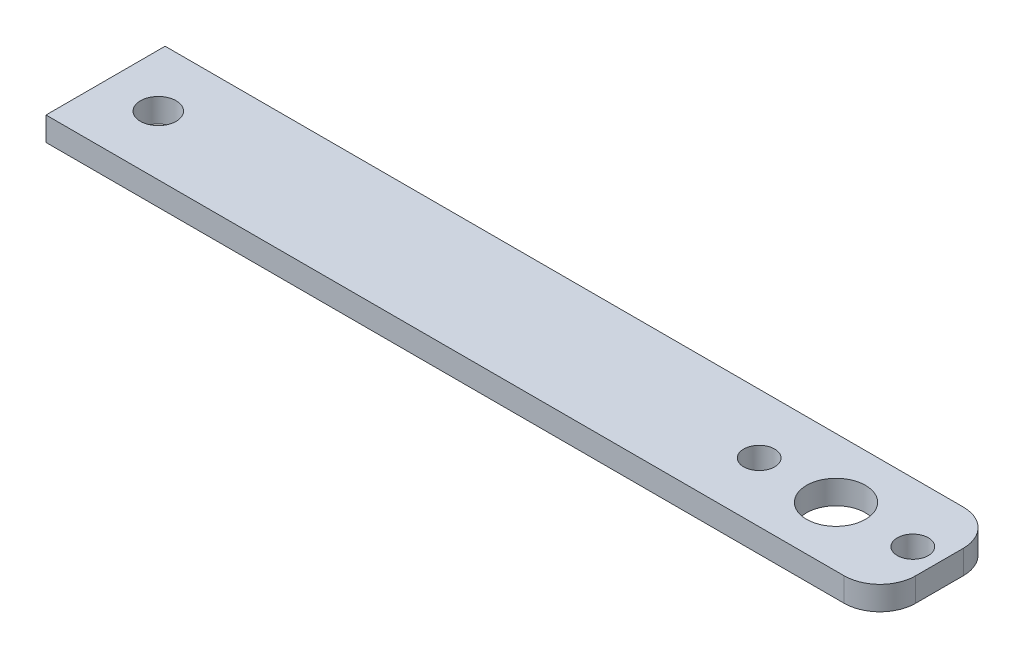
from build123d import *

# Parameters (mm, degrees)
SKETCH1_W             = 70
SKETCH1_H             = 10
BOSS_EXTRUDE1_DEPTH   = 2
SKETCH2_R             = 2.472864358
SKETCH2_R_2           = 1.3
CUT_EXTRUDE1_DEPTH    = 3
FILLET1_R             = 3
F_3_0MM_DOWEL_HOLE1_D = 3


with BuildPart() as part:
    # Sketch1 → Boss-Extrude1 (new body)
    with BuildSketch(Plane(origin=(0, 0, 0), x_dir=(1, 0, 0), z_dir=(0, 1, 0))):
        Rectangle(SKETCH1_W, SKETCH1_H)
    extrude(amount=BOSS_EXTRUDE1_DEPTH)

    # Sketch2 → Cut-Extrude1 (cut)
    with BuildSketch(Plane(origin=(0, 2, 0), x_dir=(1, 0, 0), z_dir=(0, 1, 0))):
        with Locations((26.315616253, 0)):
            Circle(SKETCH2_R)
        with Locations((32.765616253, 0)):
            Circle(SKETCH2_R_2)
        with Locations((19.865616253, 0)):
            Circle(SKETCH2_R_2)
    extrude(amount=-CUT_EXTRUDE1_DEPTH, mode=Mode.SUBTRACT)

    # Fillet1
    fillet1_edges = [part.edges().sort_by_distance(p)[0] for p in [
        (35, 1, 5),
        (35, 1, -5),
    ]]
    fillet(fillet1_edges, radius=FILLET1_R)

    # Ø3.0mm Dowel Hole1 (through all)
    with Locations(Plane(origin=(0, 2, 0), x_dir=(1, 0, 0), z_dir=(0, 1, 0))):
        with Locations((-30.573551393, 0)):
            Hole(F_3_0MM_DOWEL_HOLE1_D / 2)


solid = part.part
